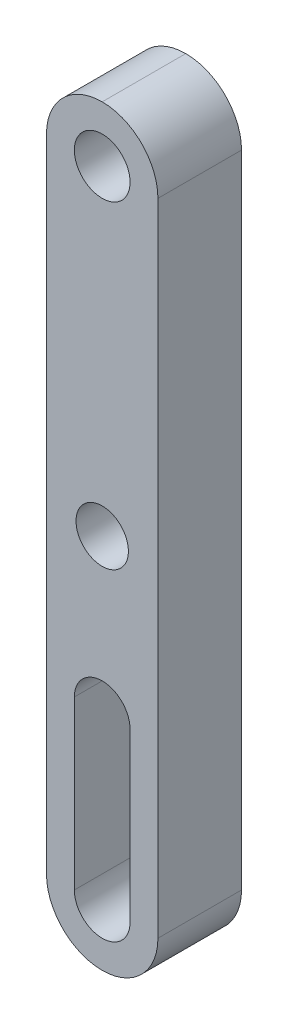
from build123d import *

# Parameters (mm, degrees)
SKETCH1_W           = 6.35
SKETCH1_H           = 42.8625
BOSS_EXTRUDE1_DEPTH = 4.7625
SKETCH2_R           = 1.49225
CUT_EXTRUDE1_DEPTH  = 23.182436922
SKETCH3_R           = 1.5875
CUT_EXTRUDE2_DEPTH  = 23.182436922
FILLET1_R           = 3.175


with BuildPart() as part:
    # Sketch1 → Boss-Extrude1 (new body)
    with BuildSketch(Plane.XY):
        Rectangle(SKETCH1_W, SKETCH1_H)
    extrude(amount=BOSS_EXTRUDE1_DEPTH)

    # Sketch2 → Cut-Extrude1 (cut, through all)
    with BuildSketch(Plane.XY.offset(4.7625)):
        Circle(SKETCH2_R)
    extrude(amount=-CUT_EXTRUDE1_DEPTH, mode=Mode.SUBTRACT)

    # Sketch3 → Cut-Extrude2 (cut, through all)
    with BuildSketch(Plane.XY.offset(4.7625)):
        with Locations((0, 18.25625)):
            Circle(SKETCH3_R)
        with BuildLine():
            Line((1.5875, -18.25625), (1.5875, -8.73125))
            ThreePointArc((1.5875, -8.73125), (0, -7.14375), (-1.5875, -8.73125))
            Line((-1.5875, -8.73125), (-1.5875, -18.25625))
            ThreePointArc((-1.5875, -18.25625), (0, -19.84375), (1.5875, -18.25625))
        make_face()
    extrude(amount=-CUT_EXTRUDE2_DEPTH, mode=Mode.SUBTRACT)

    # Fillet1
    fillet1_edges = [part.edges().sort_by_distance(p)[0] for p in [
        (-3.175, 21.43125, 2.38125),
        (3.175, 21.43125, 2.38125),
        (-3.175, -21.43125, 2.38125),
        (3.175, -21.43125, 2.38125),
    ]]
    fillet(fillet1_edges, radius=FILLET1_R - 0.0001)  # a hair under: the kernel refuses the full size


solid = part.part
